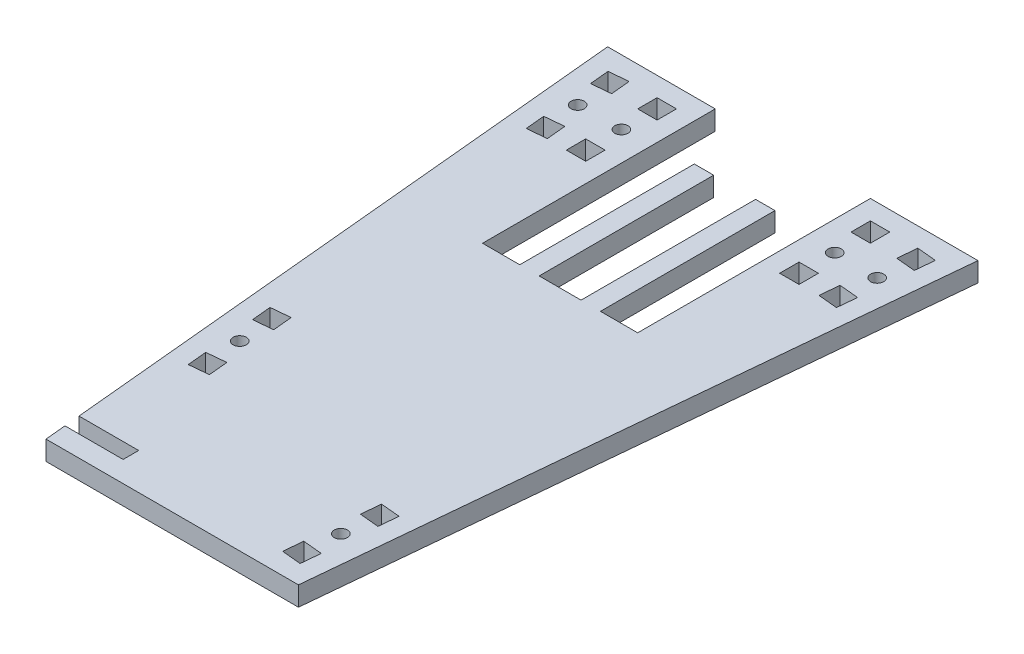
from build123d import *

# Parameters (mm, degrees)
SKETCH1_R           = 2.159
SKETCH1_W           = 6.35
SKETCH1_H           = 6.35
BOSS_EXTRUDE1_DEPTH = 6.35


with BuildPart() as part:
    # Sketch1 → Boss-Extrude1 (new body)
    with BuildSketch(Plane(origin=(0, 0, 0), x_dir=(1, 0, 0), z_dir=(0, 1, 0))):
        Polygon((-25.4, 76.2), (-47.875911854, 76.2), (-60.633073629, 76.2), (-42.466090347, -115.062), (-22.93356755, -115.062), (-22.93356755, -120.142), (-41.98356755, -120.142), (-41.332161775, -127), (-28.575, -127), (0, -127), (28.575, -127), (41.332161775, -127), (60.633073629, 76.2), (47.875911854, 76.2), (25.4, 76.2), (25.4, 0), (13.208, 0), (13.208, 57.15), (6.858, 57.15), (6.858, 0), (-6.858, 0), (-6.858, 57.15), (-13.208, 57.15), (-13.208, 0), (-25.4, 0), align=None)
        Polygon((-39.17295277, -82.578452823), (-39.773403679, -76.256905647), (-33.451856503, -75.656454737), (-32.851405593, -81.978001914), align=None, mode=Mode.SUBTRACT)
        with Locations((-37.41723431, -67.485806976)):
            Circle(SKETCH1_R, mode=Mode.SUBTRACT)
        Polygon((-35.66151585, -52.393161128), (-35.061064941, -58.714708304), (-41.382612117, -59.315159214), (-41.983063027, -52.993612037), align=None, mode=Mode.SUBTRACT)
        Polygon((29.83293553, -113.756454737), (36.154482707, -114.356905647), (35.554031797, -120.678452823), (29.232484621, -120.078001914), align=None, mode=Mode.SUBTRACT)
        with Locations((33.798313337, -105.585806976)):
            Circle(SKETCH1_R, mode=Mode.SUBTRACT)
        Polygon((37.763691145, -97.415159214), (31.442143968, -96.814708304), (32.042594878, -90.493161128), (38.364142054, -91.093612037), align=None, mode=Mode.SUBTRACT)
        Polygon((-50.786897864, 39.693161128), (-51.387348774, 46.014708304), (-45.065801597, 46.615159214), (-44.465350687, 40.293612037), align=None, mode=Mode.SUBTRACT)
        with Locations((-34.925, 43.307)):
            Rectangle(SKETCH1_W, SKETCH1_H, mode=Mode.SUBTRACT)
        with Locations((-49.031179404, 54.785806976)):
            Circle(SKETCH1_R, mode=Mode.SUBTRACT)
        Polygon((-47.275460944, 69.878452823), (-46.675010035, 63.556905647), (-52.996557211, 62.956454737), (-53.597008121, 69.278001914), align=None, mode=Mode.SUBTRACT)
        with Locations((-34.925, 54.991)):
            Circle(SKETCH1_R, mode=Mode.SUBTRACT)
        with Locations((-34.925, 66.675)):
            Rectangle(SKETCH1_W, SKETCH1_H, mode=Mode.SUBTRACT)
        with Locations((34.925, 43.307)):
            Rectangle(SKETCH1_W, SKETCH1_H, mode=Mode.SUBTRACT)
        Polygon((45.065801597, 46.615159214), (51.387348774, 46.014708304), (50.786897864, 39.693161128), (44.465350687, 40.293612037), align=None, mode=Mode.SUBTRACT)
        with Locations((34.925, 54.991)):
            Circle(SKETCH1_R, mode=Mode.SUBTRACT)
        with Locations((34.925, 66.675)):
            Rectangle(SKETCH1_W, SKETCH1_H, mode=Mode.SUBTRACT)
        with Locations((49.031179404, 54.785806976)):
            Circle(SKETCH1_R, mode=Mode.SUBTRACT)
        Polygon((52.996557211, 62.956454737), (46.675010035, 63.556905647), (47.275460944, 69.878452823), (53.597008121, 69.278001914), align=None, mode=Mode.SUBTRACT)
    extrude(amount=BOSS_EXTRUDE1_DEPTH)


solid = part.part
